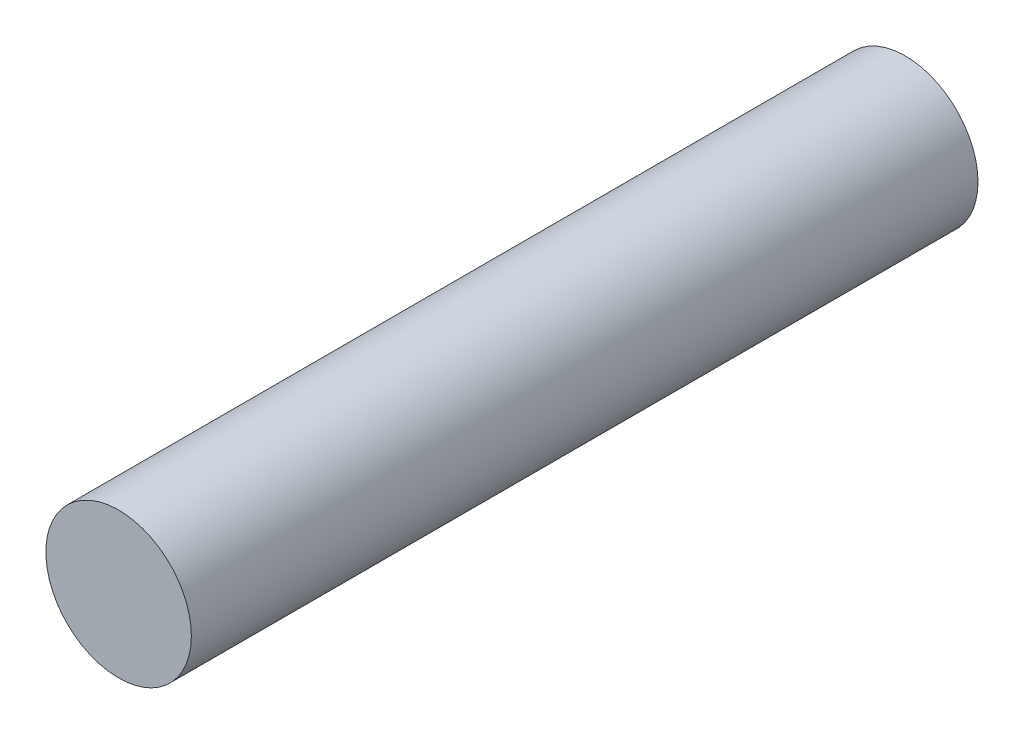
from build123d import *

# Parameters (mm, degrees)
SKETCH1_R           = 75
BOSS_EXTRUDE1_DEPTH = 811


with BuildPart() as part:
    # Sketch1 → Boss-Extrude1 (new body)
    with BuildSketch(Plane.XY):
        Circle(SKETCH1_R)
    extrude(amount=BOSS_EXTRUDE1_DEPTH)


solid = part.part
